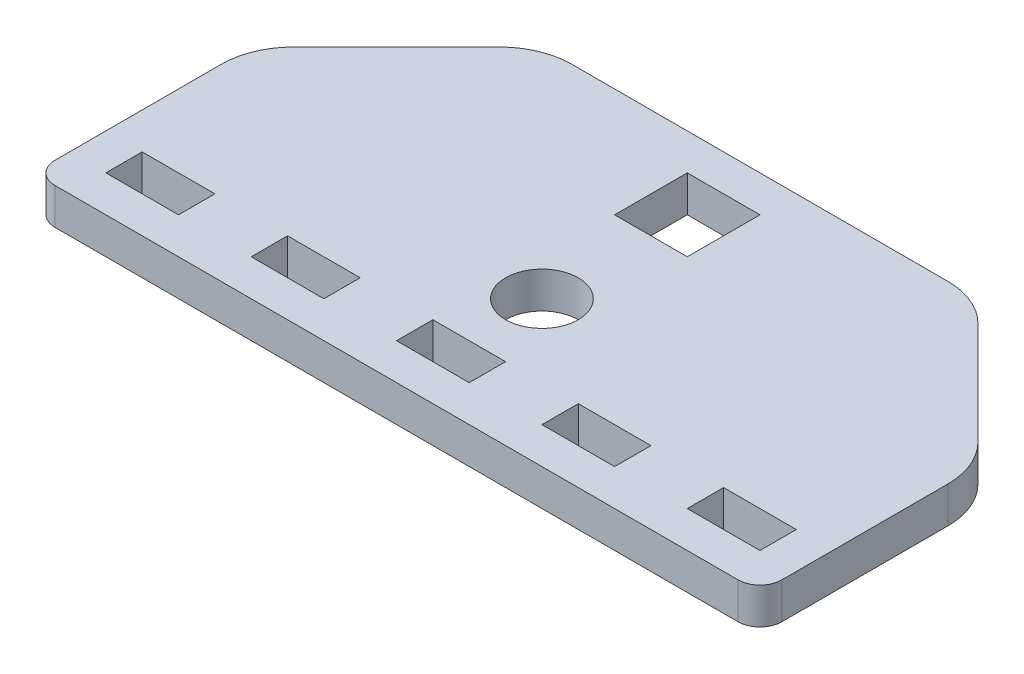
from build123d import *

# Parameters (mm, degrees)
SKETCH2_W           = 5
SKETCH2_H           = 2.5
SKETCH2_R           = 2.5
SKETCH2_H_2         = 5
BOSS_EXTRUDE1_DEPTH = 2.5


with BuildPart() as part:
    # Sketch2 → Boss-Extrude1 (new body)
    with BuildSketch(Plane(origin=(0, 0, 0), x_dir=(1, 0, 0), z_dir=(0, 1, 0))):
        with BuildLine():
            Line((-16.464466094, 11.035533906), (-23.535533906, 3.964466094))
            ThreePointArc((-23.535533906, 3.964466094), (-24.619397663, 2.34234935), (-25, 0.428932188))
            Line((-25, 0.428932188), (-25, -11))
            ThreePointArc((-25, -11), (-24.560660172, -12.060660172), (-23.5, -12.5))
            Line((-23.5, -12.5), (23.5, -12.5))
            ThreePointArc((23.5, -12.5), (24.560660172, -12.060660172), (25, -11))
            Line((25, -11), (25, 0.428932188))
            ThreePointArc((25, 0.428932188), (24.619397663, 2.34234935), (23.535533906, 3.964466094))
            Line((23.535533906, 3.964466094), (16.464466094, 11.035533906))
            ThreePointArc((16.464466094, 11.035533906), (14.84234935, 12.119397663), (12.928932188, 12.5))
            Line((12.928932188, 12.5), (-12.928932188, 12.5))
            ThreePointArc((-12.928932188, 12.5), (-14.84234935, 12.119397663), (-16.464466094, 11.035533906))
        make_face()
        with Locations((-20, -8.75)):
            Rectangle(SKETCH2_W, SKETCH2_H, mode=Mode.SUBTRACT)
        with Locations((-10, -8.75)):
            Rectangle(SKETCH2_W, SKETCH2_H, mode=Mode.SUBTRACT)
        with Locations((0, -8.75)):
            Rectangle(SKETCH2_W, SKETCH2_H, mode=Mode.SUBTRACT)
        with Locations((10, -8.75)):
            Rectangle(SKETCH2_W, SKETCH2_H, mode=Mode.SUBTRACT)
        with Locations((20, -8.75)):
            Rectangle(SKETCH2_W, SKETCH2_H, mode=Mode.SUBTRACT)
        with Locations((0, -2.5)):
            Circle(SKETCH2_R, mode=Mode.SUBTRACT)
        with Locations((0, 7.5)):
            Rectangle(SKETCH2_W, SKETCH2_H_2, mode=Mode.SUBTRACT)
    extrude(amount=BOSS_EXTRUDE1_DEPTH)


solid = part.part
